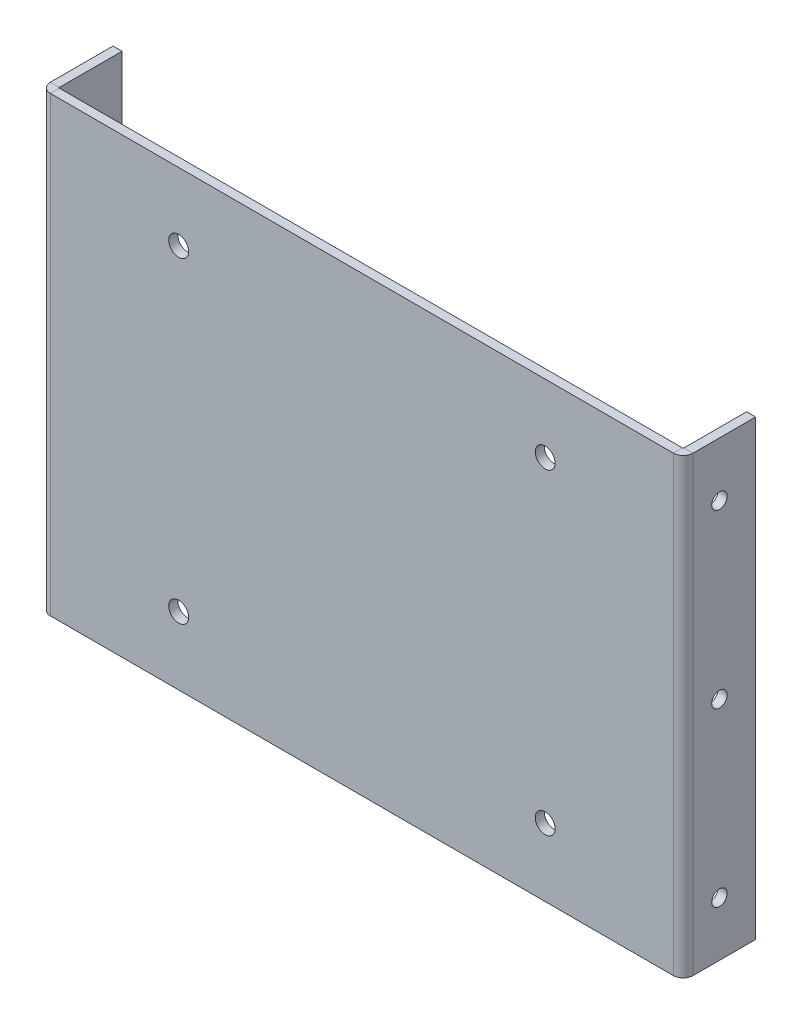
from build123d import *

# Parameters (mm, degrees)
SKETCH1_W                    = 710
SKETCH1_H                    = 500
BASE_FLANGE1_DEPTH           = 10
EDGE_FLANGE1_STRIP_W         = 41.4732
EDGE_FLANGE1_STRIP_H         = 10
EDGE_FLANGE1_STRIP_CUT_DEPTH = 500
EDGE_FLANGE1_DEPTH           = 500
EDGE_FLANGE2_STRIP_W         = 41.4732
EDGE_FLANGE2_STRIP_H         = 10
EDGE_FLANGE2_STRIP_CUT_DEPTH = 500
EDGE_FLANGE2_DEPTH           = 500
SKETCH12_R                   = 8.5
CUT_EXTRUDE1_DEPTH           = 757.967634711
LPATTERN1_COUNT              = 3
LPATTERN1_PITCH              = 190
SKETCH13_R                   = 11
CUT_EXTRUDE2_DEPTH           = 442.503114372
LPATTERN2_COUNT              = 2
LPATTERN2_PITCH              = 405
LPATTERN2_COUNT_DIR2         = 2
LPATTERN2_PITCH_DIR2         = 350


# Sheet-metal steps are written as plain solids
with BuildPart() as part:
    # Sketch1 → Base-Flange1 (new body)
    with BuildSketch(Plane.XY):
        Rectangle(SKETCH1_W, SKETCH1_H)
    extrude(amount=-BASE_FLANGE1_DEPTH)

    # Edge-Flange1 strip (across the edge) → Edge-Flange1 strip cut (cut)
    with BuildSketch(Plane(origin=(-355, -250, -10), x_dir=(1, 0, 0), z_dir=(0, 1, 0))):
        with Locations((-10, -5)):
            Rectangle(EDGE_FLANGE1_STRIP_W, EDGE_FLANGE1_STRIP_H)
    extrude(amount=EDGE_FLANGE1_STRIP_CUT_DEPTH, mode=Mode.SUBTRACT)

    # Edge-Flange1 section (across the edge) → Edge-Flange1 (add)
    with BuildSketch(Plane(origin=(-355, -250, -10), x_dir=(1, 0, 0), z_dir=(0, 1, 0))):
        with BuildLine():
            Line((0, 0.7366), (0, 70))
            Line((0, 70), (10, 70))
            Line((10, 70), (10, 0.7366))
            ThreePointArc((10, 0.7366), (10.215745145, 0.215745145), (10.7366, 0))
            Line((10.7366, 0), (10.7366, -10))
            ThreePointArc((10.7366, -10), (3.144677333, -6.855322667), (0, 0.7366))
        make_face()
    extrude(amount=EDGE_FLANGE1_DEPTH)

    # Edge-Flange2 strip (across the edge) → Edge-Flange2 strip cut (cut)
    with BuildSketch(Plane(origin=(355, 250, -10), x_dir=(-1, 0, 0), z_dir=(0, -1, 0))):
        with Locations((-10, -5)):
            Rectangle(EDGE_FLANGE2_STRIP_W, EDGE_FLANGE2_STRIP_H)
    extrude(amount=EDGE_FLANGE2_STRIP_CUT_DEPTH, mode=Mode.SUBTRACT)

    # Edge-Flange2 section (across the edge) → Edge-Flange2 (add)
    with BuildSketch(Plane(origin=(355, 250, -10), x_dir=(-1, 0, 0), z_dir=(0, -1, 0))):
        with BuildLine():
            Line((0, 0.7366), (0, 70))
            Line((0, 70), (10, 70))
            Line((10, 70), (10, 0.7366))
            ThreePointArc((10, 0.7366), (10.215745145, 0.215745145), (10.7366, 0))
            Line((10.7366, 0), (10.7366, -10))
            ThreePointArc((10.7366, -10), (3.144677333, -6.855322667), (0, 0.7366))
        make_face()
    extrude(amount=EDGE_FLANGE2_DEPTH)

    # Sketch12 → Cut-Extrude1 (cut, symmetric)
    with BuildSketch(Plane.ZY.offset(355)):
        with Locations((-40, 190)):
            Circle(SKETCH12_R)
    cut_extrude1 = extrude(amount=CUT_EXTRUDE1_DEPTH, both=True, mode=Mode.SUBTRACT)

    # LPattern1: Cut-Extrude1 ×3
    with Locations(*[(0, -i * LPATTERN1_PITCH, 0) for i in range(1, LPATTERN1_COUNT)]):
        add(cut_extrude1, mode=Mode.SUBTRACT)

    # Sketch13 → Cut-Extrude2 (cut, symmetric)
    with BuildSketch(Plane.XY):
        with Locations((202.5, 175)):
            Circle(SKETCH13_R)
    cut_extrude2 = extrude(amount=CUT_EXTRUDE2_DEPTH, both=True, mode=Mode.SUBTRACT)

    # LPattern2: Cut-Extrude2 2 × 2
    with Locations(*[(-i * LPATTERN2_PITCH, -j * LPATTERN2_PITCH_DIR2, 0) for i in range(LPATTERN2_COUNT) for j in range(LPATTERN2_COUNT_DIR2) if (i, j) != (0, 0)]):
        add(cut_extrude2, mode=Mode.SUBTRACT)


solid = part.part
